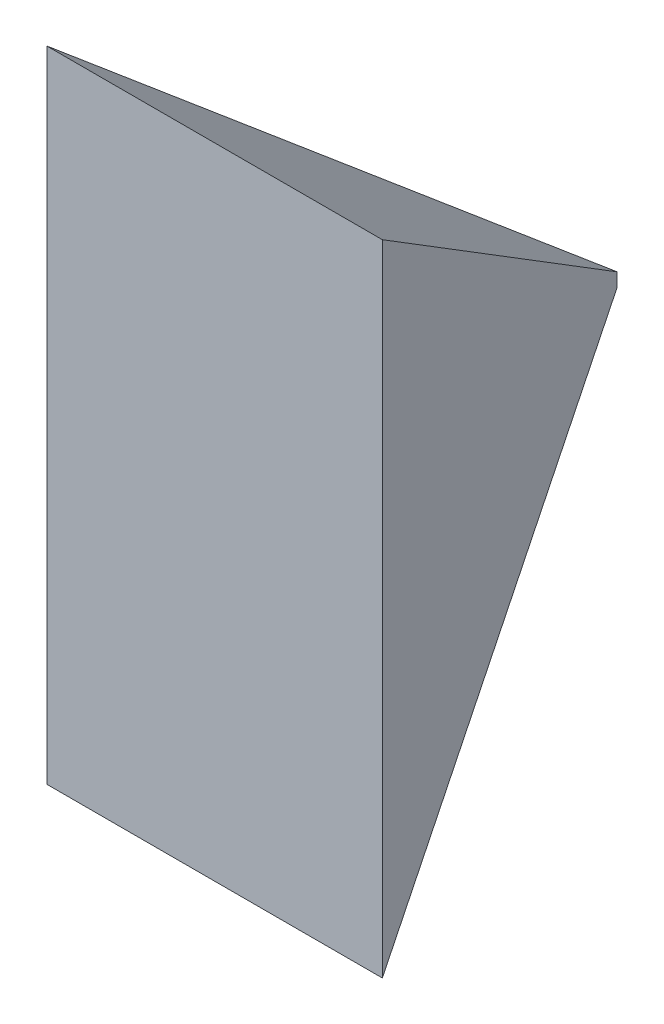
from build123d import *

# Parameters (mm, degrees)
BOSS_EXTRUDE1_DEPTH     = 47.65
CUT_EXTRUDE1_DEPTH      = 56.595195426
CUT_EXTRUDE1_DEPTH_BACK = 56.595195426


with BuildPart() as part:
    # Sketch3 → Boss-Extrude1 (new body)
    with BuildSketch(Plane(origin=(0, 0, 47.65), x_dir=(1, 0, 0), z_dir=(0, 1, 0))):
        Polygon((-12.5, 47.65), (0, 77.65), (12.5, 47.65), align=None)
    extrude(amount=BOSS_EXTRUDE1_DEPTH)

    # Sketch4 → Cut-Extrude1 (cut, two sides: drawn at the far end of the back side and taken through both)
    with BuildSketch(Plane(origin=(0, 0, -4.230769231), x_dir=(0, 0, -1), z_dir=(1, 0, 0)).offset(-CUT_EXTRUDE1_DEPTH_BACK)):
        Polygon((-4.230769231, 47.65), (25.769230769, 24.325), (25.769230769, 47.65), align=None)
        Polygon((-4.230769231, 0), (25.769230769, 0), (25.769230769, 23.325), align=None)
    extrude(amount=CUT_EXTRUDE1_DEPTH + CUT_EXTRUDE1_DEPTH_BACK, mode=Mode.SUBTRACT)


solid = part.part
